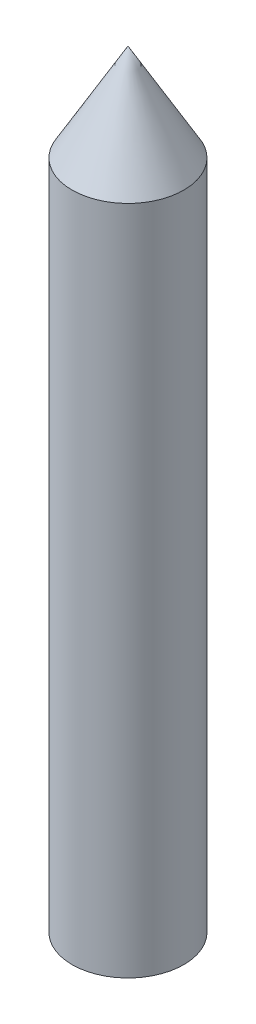
from build123d import *

# Parameters (mm, degrees)
SKETCH1_R           = 15
BOSS_EXTRUDE4_DEPTH = 200
SKETCH1_7_R         = 15
SKETCH1_7_R_2       = 12.7
BOSS_EXTRUDE5_DEPTH = 180


# Read off the part's stored shape, not the designer's step: Draft4
with BuildPart() as part:
    # Sketch1 → Boss-Extrude4 (new body)
    with BuildSketch(Plane(origin=(0, 0, 0), x_dir=(1, 0, 0), z_dir=(0, 1, 0))):
        with Locations(Location((0, 0, 0), (0, 0, 270))):
            Circle(SKETCH1_R)
    extrude(amount=BOSS_EXTRUDE4_DEPTH)

    # Draft4 outline → Draft4 (revolve, cut)
    with BuildSketch(Plane.XY):
        Polygon((15, 0), (15, 200), (0, 200), (0, 25.980762114), align=None)
    revolve(axis=Axis((0, 0, 0), (0, 1, 0)), mode=Mode.SUBTRACT)

    # Sketch1<7> → Boss-Extrude5 (add)
    with BuildSketch(Plane(origin=(0, 0, 0), x_dir=(1, 0, 0), z_dir=(0, 1, 0))):
        with Locations(Location((0, 0, 0), (0, 0, 270))):
            Circle(SKETCH1_7_R)
        with Locations(Location((0, 0, 0), (0, 0, 270))):
            Circle(SKETCH1_7_R_2, mode=Mode.SUBTRACT)
    extrude(amount=-BOSS_EXTRUDE5_DEPTH)


solid = part.part
